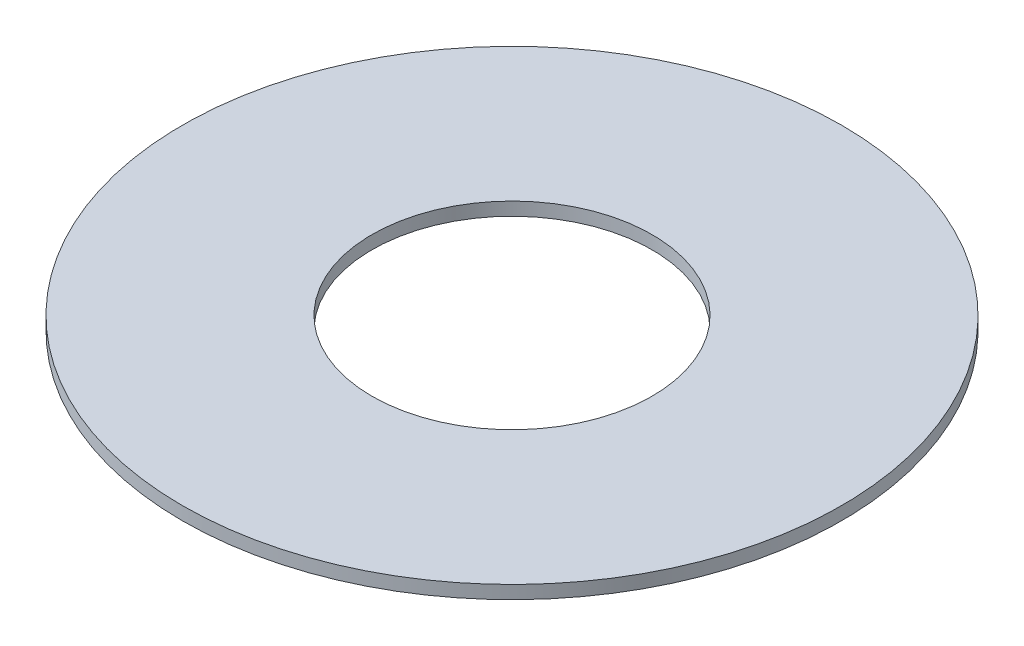
from build123d import *

# Parameters (mm, degrees)
SKETCH1_R           = 100
BOSS_EXTRUDE1_DEPTH = 4
SKETCH2_R           = 42.5
CUT_EXTRUDE1_DEPTH  = 142.477913471


with BuildPart() as part:
    # Sketch1 → Boss-Extrude1 (new body)
    with BuildSketch(Plane(origin=(0, 0, 0), x_dir=(1, 0, 0), z_dir=(0, 1, 0))):
        Circle(SKETCH1_R)
    extrude(amount=BOSS_EXTRUDE1_DEPTH)

    # Sketch2 → Cut-Extrude1 (cut, through all)
    with BuildSketch(Plane(origin=(0, 0, 0), x_dir=(1, 0, 0), z_dir=(0, 1, 0))):
        Circle(SKETCH2_R)
    extrude(amount=CUT_EXTRUDE1_DEPTH, mode=Mode.SUBTRACT)


solid = part.part
